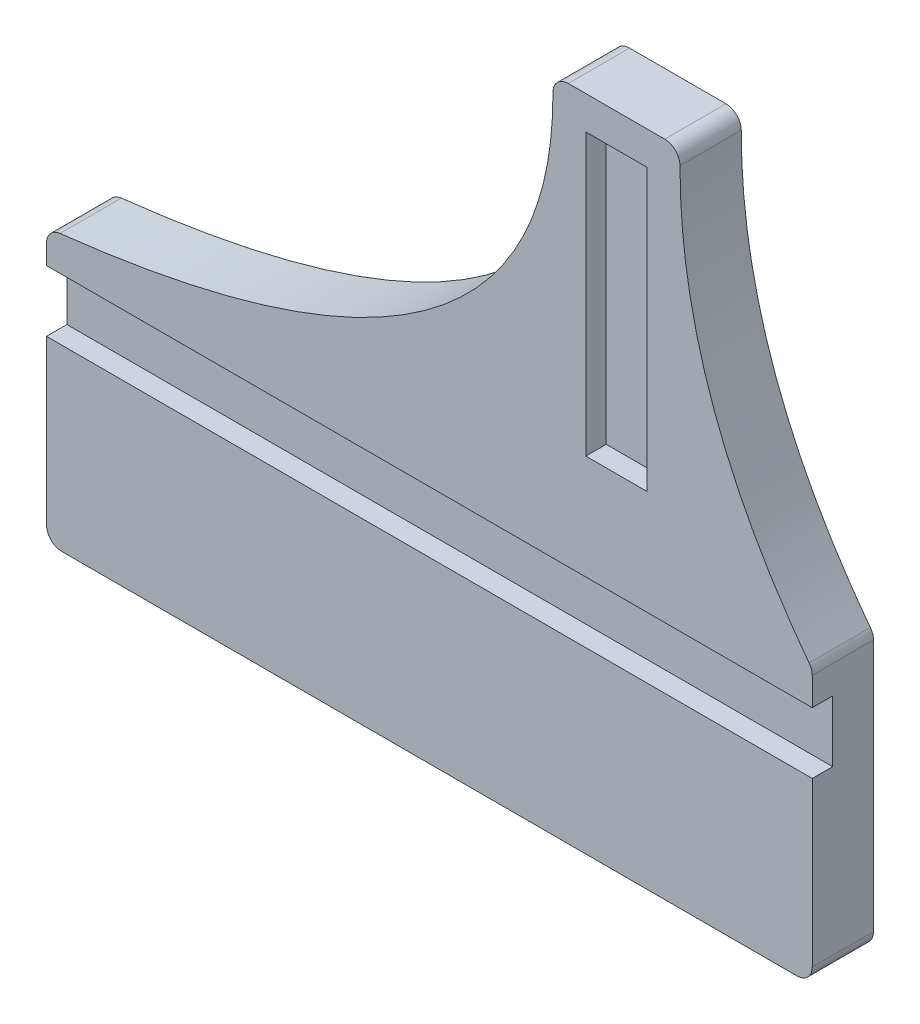
from build123d import *

# Parameters (mm, degrees)
AUFSATZ_LINEAR_AUSTRAGEN1_DEPTH = 12
SKIZZE1_4_W                     = 150
SKIZZE1_4_H                     = 12
SKIZZE1_4_W_2                   = 12
SKIZZE1_4_H_2                   = 55
SCHNITT_LINEAR_AUSTRAGEN2_DEPTH = 4
VERRUNDUNG1_R                   = 3


with BuildPart() as part:
    # Skizze1 → Aufsatz-Linear austragen1 (new body)
    with BuildSketch(Plane.XY):
        with BuildLine():
            Line((49.14, 88), (24.14, 88))
            add(Edge.make_bspline(
                [(24.14, 88), (26.807525043, 22.962561466), (-75, 12.5)],
                knots=[0, 0, 0, 1, 1, 1], degree=2))
            Line((-75, 12.5), (-75, -41))
            Line((-75, -41), (75, -41))
            Line((75, -41), (75, 12.5))
            add(Edge.make_bspline(
                [(49.14, 88), (47.999428855, 47.699903884), (75, 12.5)],
                knots=[0, 0, 0, 1, 1, 1], degree=2))
        make_face()
    extrude(amount=-AUFSATZ_LINEAR_AUSTRAGEN1_DEPTH)

    # Skizze1<4> → Schnitt-Linear austragen2 (cut)
    with BuildSketch(Plane.XY):
        Rectangle(SKIZZE1_4_W, SKIZZE1_4_H)
        with Locations((36.64, 54)):
            Rectangle(SKIZZE1_4_W_2, SKIZZE1_4_H_2)
    extrude(amount=-SCHNITT_LINEAR_AUSTRAGEN2_DEPTH, mode=Mode.SUBTRACT)

    # Verrundung1
    verrundung1_edges = [part.edges().sort_by_distance(p)[0] for p in [
        (75, -41, -6),
        (75, 12.5, -6),
        (49.14, 88, -6),
        (-75, -41, -6),
        (-75, 12.5, -6),
        (24.14, 88, -6),
    ]]
    fillet(verrundung1_edges, radius=VERRUNDUNG1_R)


solid = part.part
